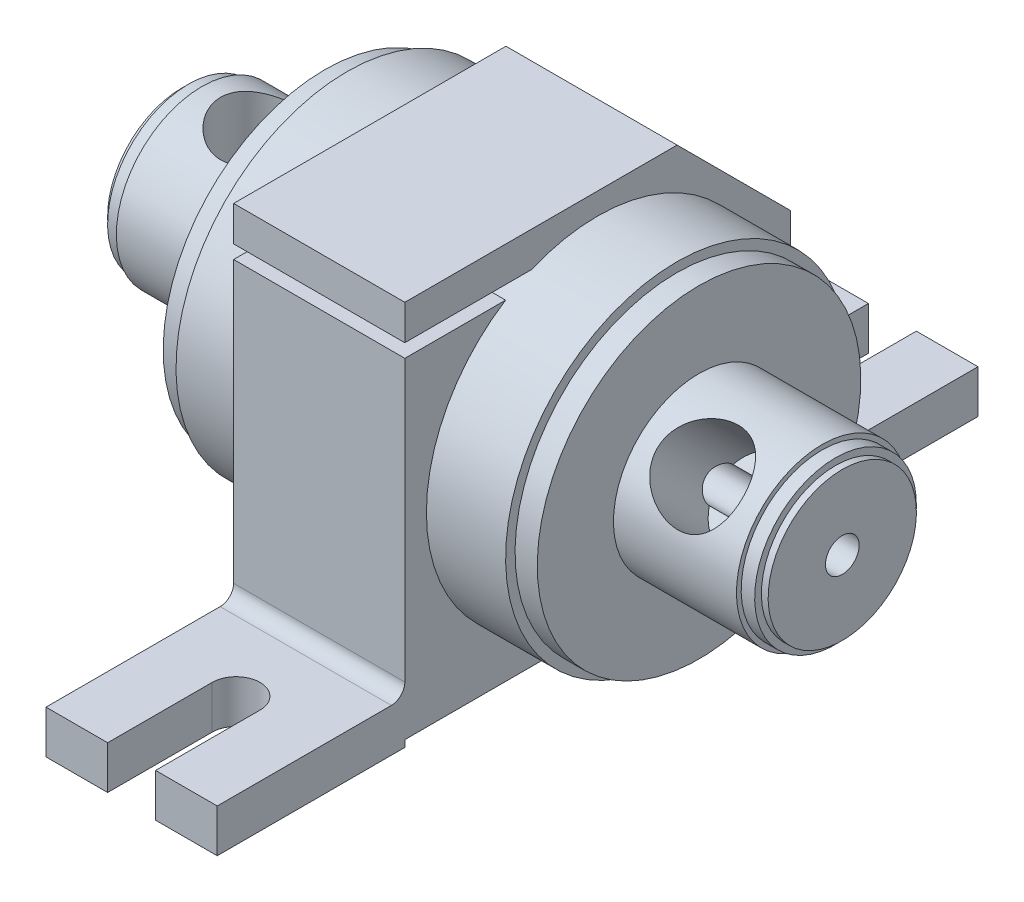
from build123d import *

# Parameters (mm, degrees)
CUT_EXTRUDE1_REACH  = 62.756
SKETCH2_R           = 6.35
CUT_EXTRUDE2_REACH  = 62.756
SKETCH3_R           = 6.35
BOSS_EXTRUDE1_DEPTH = 12.7
CUT_EXTRUDE3_DEPTH  = 25.4


with BuildPart() as part:
    # Sketch1 → Revolve1 (revolve)
    with BuildSketch(Plane.XY):
        Polygon((-49, 2.5), (-49, 11), (-48, 11), (-48, 12), (-46, 12), (-46, 12.7), (-27.75, 12.7), (-27.75, 24), (-24.45, 24), (-24.45, 25.4), (24.45, 25.4), (24.45, 24), (27.75, 24), (27.75, 12.7), (46, 12.7), (46, 12), (48, 12), (48, 11), (49, 11), (49, 2.5), align=None)
    revolve(axis=Axis((21.180623333, 0, 0), (-1, 0, 0)))

    # Sketch2 → Cut-Extrude1 (cut, up to next)
    with BuildSketch(Plane(origin=(0, 0, 0), x_dir=(1, 0, 0), z_dir=(0, 1, 0)), mode=Mode.PRIVATE) as cut_extrude1_sk1:
        with Locations((-36.875, 0)):
            Circle(SKETCH2_R)
    cut_extrude1_tool1 = extrude(cut_extrude1_sk1.sketch, amount=CUT_EXTRUDE1_REACH, mode=Mode.PRIVATE) & part.part
    add(cut_extrude1_tool1.solids().sort_by_distance((-36.875, 0, 0))[0], mode=Mode.SUBTRACT)

    # Sketch3 → Cut-Extrude2 (cut, up to next)
    with BuildSketch(Plane(origin=(0, 0, 0), x_dir=(-1, 0, 0), z_dir=(0, 0.7071067811865488, 0.7071067811865464)), mode=Mode.PRIVATE) as cut_extrude2_sk1:
        with Locations((-36.875, 0)):
            Circle(SKETCH3_R)
    cut_extrude2_tool1 = extrude(cut_extrude2_sk1.sketch, amount=CUT_EXTRUDE2_REACH, mode=Mode.PRIVATE) & part.part
    add(cut_extrude2_tool1.solids().sort_by_distance((36.875, 0, 0))[0], mode=Mode.SUBTRACT)

    # Sketch4 → Boss-Extrude1 (add, symmetric)
    with BuildSketch(Plane(origin=(0, 0, 0), x_dir=(0, 0, -1), z_dir=(1, 0, 0))):
        with BuildLine():
            Line((11.8, 28.62), (-28.6, 28.62))
            Line((-28.6, 28.62), (-28.6, 23.42))
            Line((-28.6, 23.42), (-9.831764847, 23.42))
            ThreePointArc((-9.831764847, 23.42), (11.783776747, -22.501168982), (-13.650772872, 21.42))
            Line((-13.650772872, 21.42), (-28.6, 21.42))
            Line((-28.6, 21.42), (-28.6, -20.18))
            ThreePointArc((-28.6, -20.18), (-29.185786438, -21.594213562), (-30.6, -22.18))
            Line((-30.6, -22.18), (-56.436918481, -22.18))
            Line((-56.436918481, -22.18), (-56.436918481, -28.58))
            Line((-56.436918481, -28.58), (-28.6, -28.58))
            Line((-28.6, -28.58), (-28.6, -27.58))
            Line((-28.6, -27.58), (28.6, -27.58))
            Line((28.6, -27.58), (28.6, -28.58))
            Line((28.6, -28.58), (56.436918481, -28.58))
            Line((56.436918481, -28.58), (56.436918481, -22.18))
            Line((56.436918481, -22.18), (30.6, -22.18))
            ThreePointArc((30.6, -22.18), (29.185786438, -21.594213562), (28.6, -20.18))
            Line((28.6, -20.18), (28.6, 11.82))
            Line((28.6, 11.82), (11.8, 28.62))
        make_face()
    extrude(amount=BOSS_EXTRUDE1_DEPTH, both=True)

    # Sketch5 → Cut-Extrude3 (cut)
    with BuildSketch(Plane(origin=(0, -22.18, 0), x_dir=(1, 0, 0), z_dir=(0, 1, 0))):
        with BuildLine():
            Line((3.555, 56.436918481), (3.555, 40.936918481))
            ThreePointArc((3.555, 40.936918481), (0, 37.381918481), (-3.555, 40.936918481))
            Line((-3.555, 40.936918481), (-3.555, 56.436918481))
            ThreePointArc((-3.555, 56.436918481), (0, 59.991918481), (3.555, 56.436918481))
        make_face()
        with BuildLine():
            Line((-3.555, -56.436918481), (-3.555, -40.936918481))
            ThreePointArc((-3.555, -40.936918481), (0, -37.381918481), (3.555, -40.936918481))
            Line((3.555, -40.936918481), (3.555, -56.436918481))
            ThreePointArc((3.555, -56.436918481), (0, -59.991918481), (-3.555, -56.436918481))
        make_face()
    extrude(amount=-CUT_EXTRUDE3_DEPTH, mode=Mode.SUBTRACT)


solid = part.part
